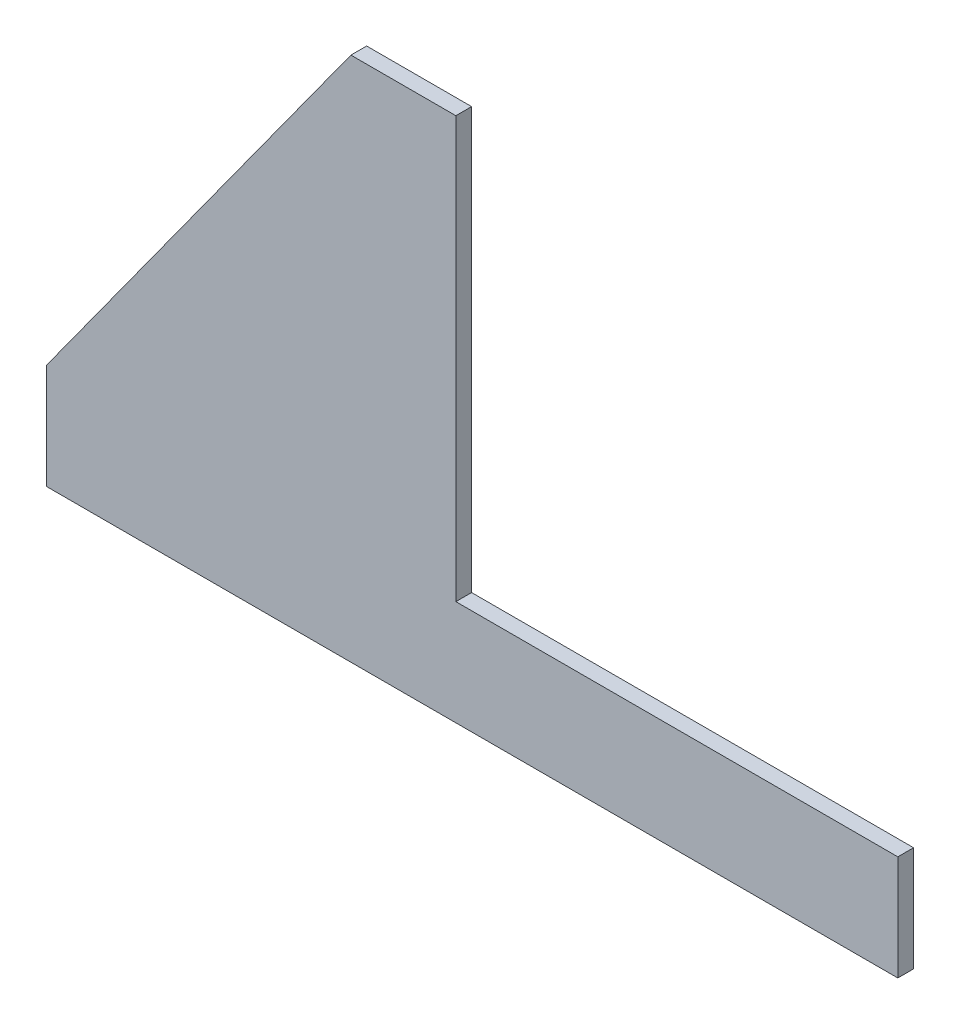
from build123d import *

# Parameters (mm, degrees)
SALIENTE_EXTRUIR1_DEPTH = 15


with BuildPart() as part:
    # Croquis1 → Saliente-Extruir1 (new body)
    with BuildSketch(Plane.XY):
        Polygon((-15.5, 50), (405.6, 50), (405.6, -50), (-405.6, -50), (-405.6, 50), (-115.5, 451), (-15.5, 451), align=None)
    extrude(amount=SALIENTE_EXTRUIR1_DEPTH)


solid = part.part
